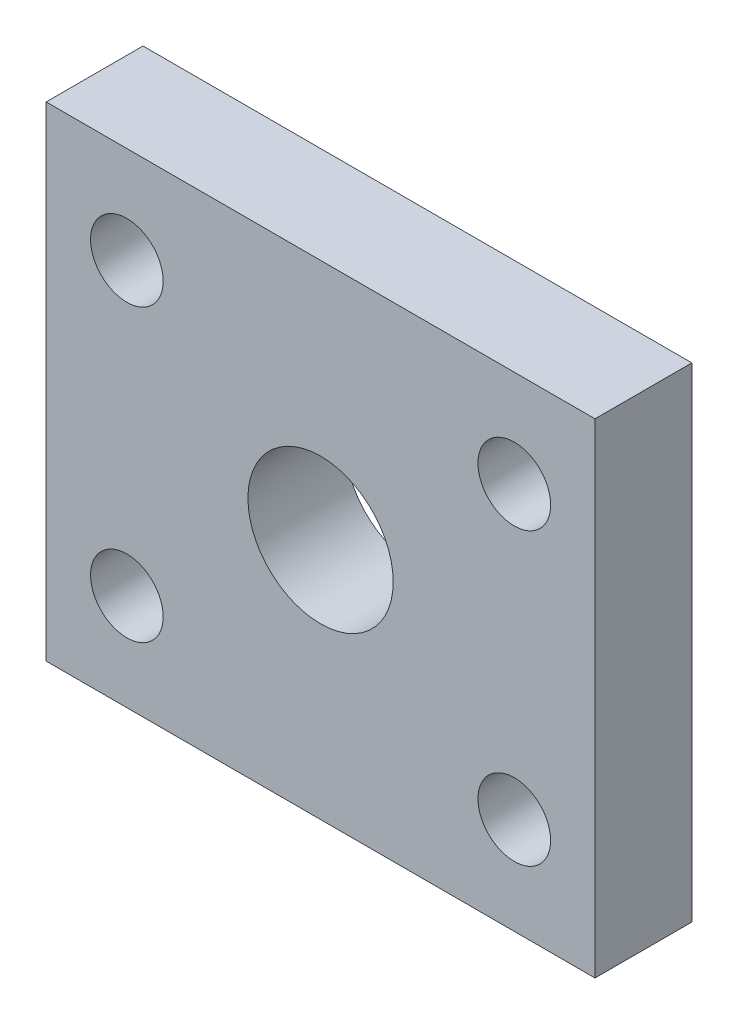
from build123d import *

# Parameters (mm, degrees)
SKETCH2_W           = 34
SKETCH2_H           = 30
BOSS_EXTRUDE1_DEPTH = 6
SKETCH3_R           = 2.25
CUT_EXTRUDE1_DEPTH  = 10
SKETCH4_R           = 4.5
CUT_EXTRUDE2_DEPTH  = 10


with BuildPart() as part:
    # Sketch2 → Boss-Extrude1 (new body)
    with BuildSketch(Plane.XY):
        Rectangle(SKETCH2_W, SKETCH2_H)
    extrude(amount=BOSS_EXTRUDE1_DEPTH)

    # Sketch3 → Cut-Extrude1 (cut)
    with BuildSketch(Plane(origin=(0, 0, 0), x_dir=(-1, 0, 0), z_dir=(0, 0, -1))):
        with Locations((-12, 9)):
            Circle(SKETCH3_R)
        with Locations((12, 9)):
            Circle(SKETCH3_R)
        with Locations((12, -9)):
            Circle(SKETCH3_R)
        with Locations((-12, -9)):
            Circle(SKETCH3_R)
    extrude(amount=-CUT_EXTRUDE1_DEPTH, mode=Mode.SUBTRACT)

    # Sketch4 → Cut-Extrude2 (cut)
    with BuildSketch(Plane(origin=(0, 0, 0), x_dir=(-1, 0, 0), z_dir=(0, 0, -1))):
        Circle(SKETCH4_R)
    extrude(amount=-CUT_EXTRUDE2_DEPTH, mode=Mode.SUBTRACT)


solid = part.part
